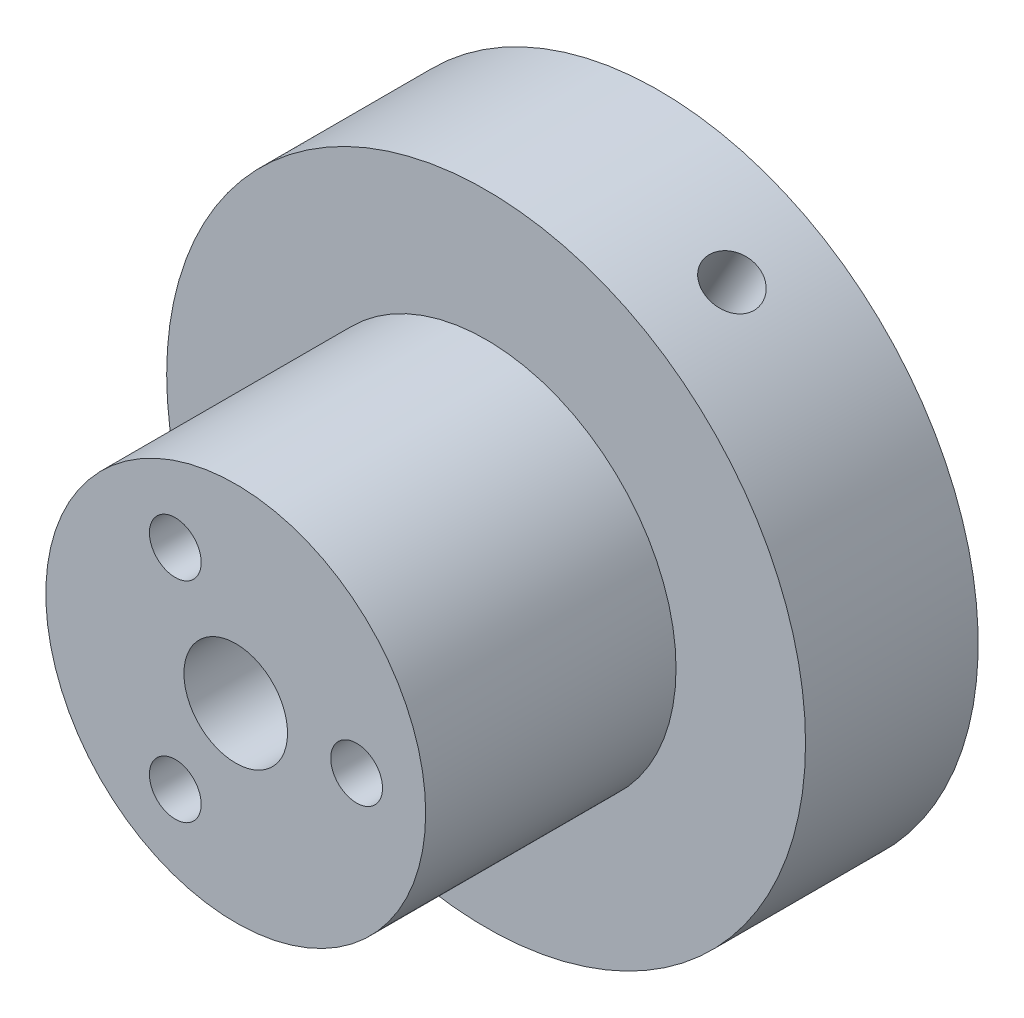
from build123d import *

# Parameters (mm, degrees)
SKETCH1_R           = 18.5
BOSS_EXTRUDE1_DEPTH = 3
SKETCH2_R           = 11
BOSS_EXTRUDE2_DEPTH = 3.5
SKETCH4_R           = 3.05
CUT_EXTRUDE1_DEPTH  = 4.1
SKETCH5_R           = 1.5
CUT_EXTRUDE2_DEPTH  = 4
SKETCH7_R           = 11
SKETCH7_R_2         = 3
BOSS_EXTRUDE3_DEPTH = 11
SKETCH9_R           = 1.5
CUT_EXTRUDE4_DEPTH  = 32.476181471
SKETCH10_R          = 3
CUT_EXTRUDE5_DEPTH  = 32.476181471
SKETCH11_R          = 3.25
CUT_EXTRUDE8_DEPTH  = 10
BOSS_EXTRUDE4_START = 7
SKETCH12_R          = 18.5
SKETCH12_R_2        = 3.25
SKETCH12_R_3        = 3.05
BOSS_EXTRUDE4_DEPTH = 7
CUT_EXTRUDE9_START  = -5
SKETCH13_R          = 1.5
CUT_EXTRUDE9_DEPTH  = 17
CIRPATTERN1_COUNT   = 3


with BuildPart() as part:
    # Sketch1 → Boss-Extrude1 (new body)
    with BuildSketch(Plane.XY):
        Circle(SKETCH1_R)
    extrude(amount=BOSS_EXTRUDE1_DEPTH)

    # Sketch2 → Boss-Extrude2 (add)
    with BuildSketch(Plane.XY.offset(3)):
        Circle(SKETCH2_R)
    extrude(amount=BOSS_EXTRUDE2_DEPTH)

    # Sketch4 → Cut-Extrude1 (cut)
    with BuildSketch(Plane(origin=(0, 0, 0), x_dir=(-1, 0, 0), z_dir=(0, 0, -1))):
        Circle(SKETCH4_R)
    extrude(amount=-CUT_EXTRUDE1_DEPTH, mode=Mode.SUBTRACT)

    # Sketch5 → Cut-Extrude2 (cut)
    with BuildSketch(Plane(origin=(0, 0, 4.1), x_dir=(-1, 0, 0), z_dir=(0, 0, -1))):
        Circle(SKETCH5_R)
    extrude(amount=-CUT_EXTRUDE2_DEPTH, mode=Mode.SUBTRACT)

    # Sketch7 → Boss-Extrude3 (add)
    with BuildSketch(Plane.XY.offset(6.5)):
        Circle(SKETCH7_R)
        Circle(SKETCH7_R_2, mode=Mode.SUBTRACT)
    extrude(amount=BOSS_EXTRUDE3_DEPTH)

    # Sketch9 → Cut-Extrude4 (cut, through all)
    with BuildSketch(Plane.XY.offset(17.5)):
        with Locations((7, 0)):
            Circle(SKETCH9_R)
        with Locations((-3.5, -6.062177826)):
            Circle(SKETCH9_R)
        with Locations((-3.5, 6.062177826)):
            Circle(SKETCH9_R)
    extrude(amount=-CUT_EXTRUDE4_DEPTH, mode=Mode.SUBTRACT)

    # Sketch10 → Cut-Extrude5 (cut, through all)
    with BuildSketch(Plane.XY.offset(17.5)):
        Circle(SKETCH10_R)
    extrude(amount=-CUT_EXTRUDE5_DEPTH, mode=Mode.SUBTRACT)

    # Sketch11 → Cut-Extrude8 (cut)
    with BuildSketch(Plane(origin=(0, 0, 0), x_dir=(-1, 0, 0), z_dir=(0, 0, -1))):
        with Locations((3.5, -6.062177826)):
            Circle(SKETCH11_R)
        with Locations((3.5, 6.062177826)):
            Circle(SKETCH11_R)
        with Locations((-7, 0)):
            Circle(SKETCH11_R)
    extrude(amount=-CUT_EXTRUDE8_DEPTH, mode=Mode.SUBTRACT)

    # Sketch12 → Boss-Extrude4 (add)
    with BuildSketch(Plane(origin=(0, 0, 0), x_dir=(-1, 0, 0), z_dir=(0, 0, -1)).offset(BOSS_EXTRUDE4_START)):
        Circle(SKETCH12_R)
        with Locations((3.5, 6.062177826)):
            Circle(SKETCH12_R_2, mode=Mode.SUBTRACT)
        with Locations((3.5, -6.062177826)):
            Circle(SKETCH12_R_2, mode=Mode.SUBTRACT)
        with Locations((-7, 0)):
            Circle(SKETCH12_R_2, mode=Mode.SUBTRACT)
        Circle(SKETCH12_R_3, mode=Mode.SUBTRACT)
    extrude(amount=-BOSS_EXTRUDE4_DEPTH)

    # Sketch13 → Cut-Extrude9 (cut)
    with BuildSketch(Plane(origin=(0, 0, 0), x_dir=(0, 0, -1), z_dir=(1, 0, 0)).offset(CUT_EXTRUDE9_START)):
        with Locations((2, 0)):
            Circle(SKETCH13_R)
    cut_extrude9 = extrude(amount=-CUT_EXTRUDE9_DEPTH, mode=Mode.SUBTRACT)

    # CirPattern1: Cut-Extrude9 ×3 about axis
    cirpattern1_axis = Axis((0, 0, 3), (0, 0, -1))
    for i in range(1, CIRPATTERN1_COUNT):
        add(cut_extrude9.rotate(cirpattern1_axis, i * 360 / CIRPATTERN1_COUNT), mode=Mode.SUBTRACT)


solid = part.part
